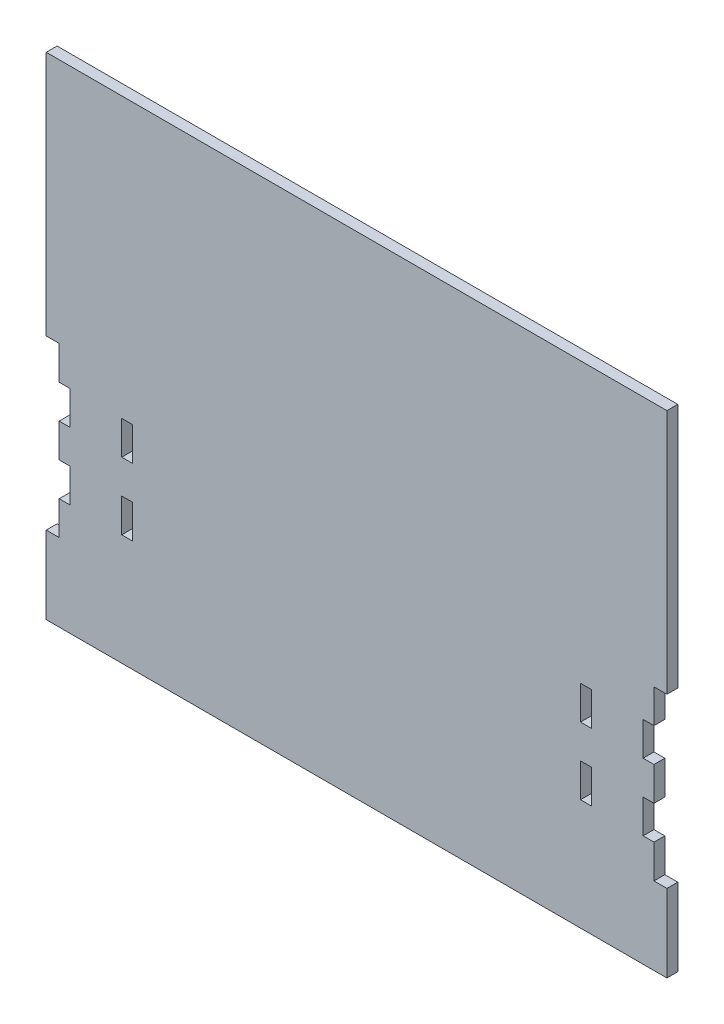
from build123d import *

# Parameters (mm, degrees)
SKETCH1_W           = 304.8
SKETCH1_H           = 241.3
BOSS_EXTRUDE1_DEPTH = 5.334
SKETCH2_W           = 6.35
SKETCH2_H           = 82.55
CUT_EXTRUDE1_DEPTH  = 195.44956687
SKETCH9_W           = 5.334
SKETCH9_H           = 16.51
CUT_EXTRUDE2_DEPTH  = 195.44956687
SKETCH23_W          = 5.334
SKETCH23_H          = 16.51
CUT_EXTRUDE8_DEPTH  = 195.44956687


with BuildPart() as part:
    # Sketch1 → Boss-Extrude1 (new body)
    with BuildSketch(Plane.XY):
        Rectangle(SKETCH1_W, SKETCH1_H)
    extrude(amount=BOSS_EXTRUDE1_DEPTH)

    # Sketch2 → Cut-Extrude1 (cut, through all)
    with BuildSketch(Plane(origin=(0, 0, 0), x_dir=(-1, 0, 0), z_dir=(0, 0, -1))):
        with Locations((149.225, -41.275)):
            Rectangle(SKETCH2_W, SKETCH2_H)
        with Locations((-149.225, -41.275)):
            Rectangle(SKETCH2_W, SKETCH2_H)
    extrude(amount=-CUT_EXTRUDE1_DEPTH, mode=Mode.SUBTRACT)

    # Sketch9 → Cut-Extrude2 (cut, through all)
    with BuildSketch(Plane.XY.offset(5.334)):
        with Locations((-143.383, -24.765)):
            Rectangle(SKETCH9_W, SKETCH9_H)
        with Locations((-143.383, -57.785)):
            Rectangle(SKETCH9_W, SKETCH9_H)
        with Locations((143.383, -57.785)):
            Rectangle(SKETCH9_W, SKETCH9_H)
        with Locations((143.383, -24.765)):
            Rectangle(SKETCH9_W, SKETCH9_H)
    extrude(amount=-CUT_EXTRUDE2_DEPTH, mode=Mode.SUBTRACT)

    # Sketch23 → Cut-Extrude8 (cut, through all)
    with BuildSketch(Plane.XY.offset(5.334)):
        with Locations((-112.649, -57.785)):
            Rectangle(SKETCH23_W, SKETCH23_H)
        with Locations((112.649, -24.765)):
            Rectangle(SKETCH23_W, SKETCH23_H)
        with Locations((112.649, -57.785)):
            Rectangle(SKETCH23_W, SKETCH23_H)
        with Locations((-112.649, -24.765)):
            Rectangle(SKETCH23_W, SKETCH23_H)
    extrude(amount=-CUT_EXTRUDE8_DEPTH, mode=Mode.SUBTRACT)


solid = part.part
